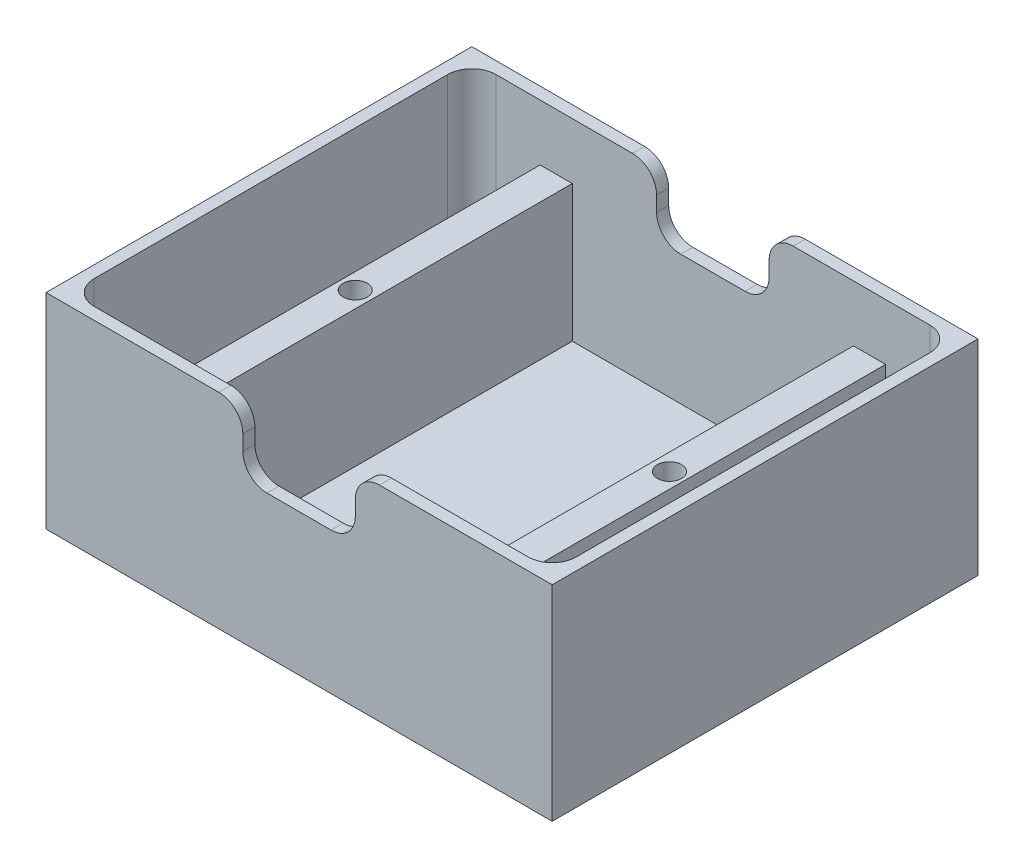
from build123d import *

# Parameters (mm, degrees)
SKETCH1_W           = 60
SKETCH1_H           = 50
BOSS_EXTRUDE1_DEPTH = 24
SHELL1_T            = 1.5
SKETCH2_W           = 4
SKETCH2_H           = 50
BOSS_EXTRUDE2_DEPTH = 17
SKETCH4_R           = 1.5
CUT_EXTRUDE1_DEPTH  = 8
SKETCH6_W           = 14
SKETCH6_H           = 12
CUT_EXTRUDE2_DEPTH  = 58
FILLET1_R           = 3


with BuildPart() as part:
    # Sketch1 → Boss-Extrude1 (new body)
    with BuildSketch(Plane(origin=(0, 0, 0), x_dir=(1, 0, 0), z_dir=(0, 1, 0))):
        with Locations((30, -25)):
            Rectangle(SKETCH1_W, SKETCH1_H)
    extrude(amount=BOSS_EXTRUDE1_DEPTH)

    # Shell1
    shell1_openings = [part.faces().sort_by_distance(p)[0] for p in [
        (30, 24, 25),
    ]]
    offset(amount=SHELL1_T, openings=shell1_openings, kind=Kind.INTERSECTION)

    # Sketch2 → Boss-Extrude2 (add)
    with BuildSketch(Plane(origin=(0, 0, 0), x_dir=(1, 0, 0), z_dir=(0, 1, 0))):
        with Locations((10.5, -25)):
            Rectangle(SKETCH2_W, SKETCH2_H)
        with Locations((49.5, -25)):
            Rectangle(SKETCH2_W, SKETCH2_H)
    extrude(amount=BOSS_EXTRUDE2_DEPTH)

    # Sketch4 → Cut-Extrude1 (cut)
    with BuildSketch(Plane(origin=(0, 17, 0), x_dir=(1, 0, 0), z_dir=(0, 1, 0))):
        with Locations((10.489990721, -25)):
            Circle(SKETCH4_R)
        with Locations((49.600386466, -25)):
            Circle(SKETCH4_R)
    extrude(amount=-CUT_EXTRUDE1_DEPTH, mode=Mode.SUBTRACT)

    # Sketch6 → Cut-Extrude2 (cut)
    with BuildSketch(Plane.XY.offset(51.5)):
        with Locations((30, 22.134691447)):
            Rectangle(SKETCH6_W, SKETCH6_H)
    extrude(amount=-CUT_EXTRUDE2_DEPTH, mode=Mode.SUBTRACT)

    # Fillet1
    fillet1_edges = [part.edges().sort_by_distance(p)[0] for p in [
        (60, 12, 50),
        (0, 12, 50),
        (60, 12, 0),
        (0, 12, 0),
        (23, 24, -0.75),
        (23, 16.134691447, -0.75),
        (37, 16.134691447, -0.75),
        (37, 24, -0.75),
        (23, 24, 50.75),
        (23, 16.134691447, 50.75),
        (37, 16.134691447, 50.75),
        (37, 24, 50.75),
    ]]
    fillet(fillet1_edges, radius=FILLET1_R)


solid = part.part
